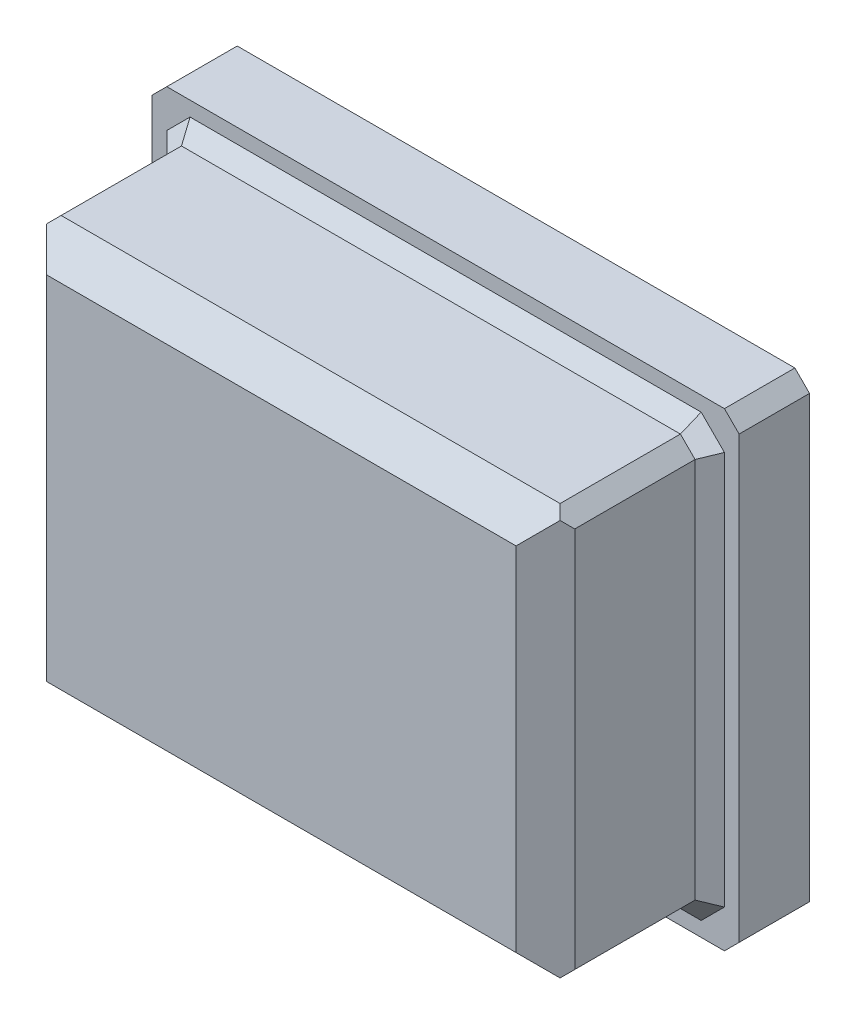
from build123d import *

# Parameters (mm, degrees)
BOSS_EXTRUDE1_DEPTH = 0.24
BOSS_EXTRUDE2_DEPTH = 0.56
CHAMFER1_SIZE       = 0.1
CHAMFER2_SIZE       = 0.05


with BuildPart() as part:
    # Sketch3 → Boss-Extrude1 (new body)
    with BuildSketch(Plane.XY):
        Polygon((-1.363809524, 0.837619048), (-1.313809524, 0.887619048), (0.586190476, 0.887619048), (0.636190476, 0.837619048), (0.636190476, -0.662380952), (0.586190476, -0.712380952), (-1.313809524, -0.712380952), (-1.363809524, -0.662380952), align=None)
    extrude(amount=BOSS_EXTRUDE1_DEPTH)

    # Sketch4 → Boss-Extrude2 (add)
    with BuildSketch(Plane.XY.offset(0.24)):
        Polygon((-1.263809524, 0.737619048), (-1.213809524, 0.787619048), (0.486190476, 0.787619048), (0.536190476, 0.737619048), (0.536190476, -0.562380952), (0.486190476, -0.612380952), (-1.213809524, -0.612380952), (-1.263809524, -0.562380952), align=None)
    extrude(amount=BOSS_EXTRUDE2_DEPTH)

    # Chamfer1
    # the kernel refuses this chamfer: 0.1 mm, written as the material it takes off along each edge
    with BuildSketch(Plane(origin=(-1.470977823, 0.787619048, 0.8), x_dir=(0, 0.027495876610586285, -0.9996219169112968), z_dir=(1, 0, 0)), Plane(origin=(0.743358775, -0.612380952, 0.8), x_dir=(0, -0.027495876610586285, -0.9996219169112968), z_dir=(-1, 0, 0))) as chamfer1_piece_1:
        Polygon((CHAMFER1_SIZE * 0.999621916911, -CHAMFER1_SIZE * 0.0274958766106), (-CHAMFER1_SIZE * 0.0274958766106, -CHAMFER1_SIZE * 0.999621916911), (0, 0), align=None)
    extrude(amount=2.214336598, mode=Mode.SUBTRACT)
    with BuildSketch(Plane(origin=(0.536190476, 0.994787346, 0.8), x_dir=(0.027495876610586285, 0, -0.9996219169112968), z_dir=(0, -1, 0)), Plane(origin=(-1.263809524, -0.819549251, 0.8), x_dir=(-0.02749587661058736, 0, -0.9996219169112966), z_dir=(0, 1, 0))) as chamfer1_piece_2:
        Polygon((CHAMFER1_SIZE * 0.999621916911, -CHAMFER1_SIZE * 0.0274958766106), (-CHAMFER1_SIZE * 0.0274958766106, -CHAMFER1_SIZE * 0.999621916911), (0, 0), align=None)
    extrude(amount=1.814336598, mode=Mode.SUBTRACT)

    # Chamfer2
    chamfer2_edges = [part.edges().sort_by_distance(p)[0] for p in [
        (-0.363809524, 0.787619048, 0.24),
        (-1.238809524, 0.762619048, 0.24),
        (-1.263809524, 0.087619048, 0.24),
        (-1.238809524, -0.587380952, 0.24),
        (-0.363809524, -0.612380952, 0.24),
        (0.511190476, -0.587380952, 0.24),
        (0.536190476, 0.087619048, 0.24),
        (0.511190476, 0.762619048, 0.24),
    ]]
    chamfer(chamfer2_edges, length=CHAMFER2_SIZE)


solid = part.part
